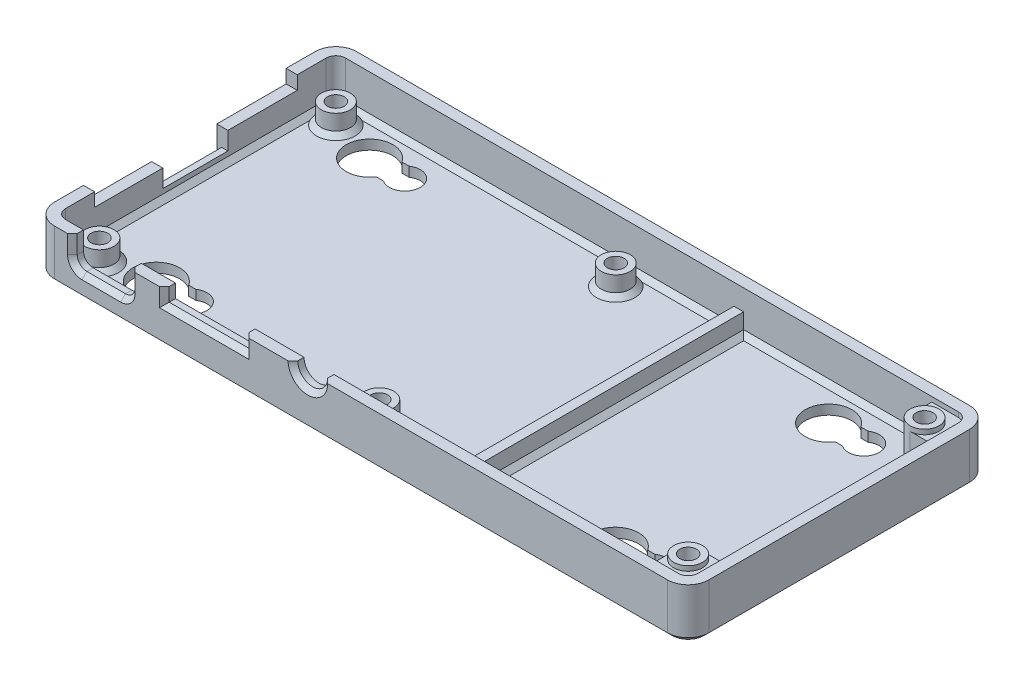
from build123d import *

# Parameters (mm, degrees)
SKETCH3_W                                         = 135.6
SKETCH3_H                                         = 62.6
SKETCH3_W_2                                       = 131
SKETCH3_H_2                                       = 58
BOSS_EXTRUDE1_DEPTH                               = 10.5
SKETCH5_W                                         = 131
SKETCH5_H                                         = 58
BOSS_EXTRUDE2_DEPTH                               = 2
SKETCH6_R                                         = 3
BOSS_EXTRUDE3_DEPTH                               = 4.2
SKETCH10_W                                        = 2
SKETCH10_H                                        = 58
BOSS_EXTRUDE4_DEPTH                               = 4.2
CUT_EXTRUDE1_REACH                                = 100.149
SKETCH11_R                                        = 3.1
SKETCH11_W                                        = 12
SKETCH11_H                                        = 5.8
SKETCH11_W_2                                      = 16.5
SKETCH11_H_2                                      = 2.8
CUT_EXTRUDE2_REACH                                = 142.29
SKETCH12_W                                        = 42
SKETCH12_H                                        = 2.8
SKETCH12_W_2                                      = 13.5
SKETCH12_H_2                                      = 3.7
FILLET6_R                                         = 2
FILLET8_R                                         = 2
CHAMFER1_SIZE                                     = 1
BOSS_EXTRUDE7_DEPTH                               = 8.5
FILLET20_R                                        = 4.3
CHAMFER5_SIZE                                     = 1
CSK_FOR_4_FLAT_HEAD_SOCKET_CAP_SCREW1_D           = 3.4544
CSK_FOR_4_FLAT_HEAD_SOCKET_CAP_SCREW1_DEPTH       = 14
CSK_FOR_4_FLAT_HEAD_SOCKET_CAP_SCREW1_CSINK_D     = 6.723761
CSK_FOR_4_FLAT_HEAD_SOCKET_CAP_SCREW1_CSINK_ANGLE = 82
CSK_FOR_4_FLAT_HEAD_SOCKET_CAP_SCREW1_TIP         = 1.037806461
CHAMFER7_SIZE                                     = 1
CUT_EXTRUDE3_START                                = -1
CUT_EXTRUDE3_DEPTH                                = 1
FILLET21_R                                        = 2
CHAMFER9_SIZE                                     = 1
CHAMFER10_SIZE                                    = 1
CUT_EXTRUDE4_DEPTH                                = 83.826966893


with BuildPart() as part:
    # Sketch3 → Boss-Extrude1 (new body)
    with BuildSketch(Plane(origin=(0, 0, 0), x_dir=(1, 0, 0), z_dir=(0, 1, 0))):
        with Locations((-7.061766162, 3.105993834)):
            Rectangle(SKETCH3_W, SKETCH3_H)
        with Locations((-7.061766162, 3.105993834)):
            Rectangle(SKETCH3_W_2, SKETCH3_H_2, mode=Mode.SUBTRACT)
    extrude(amount=BOSS_EXTRUDE1_DEPTH)

    # Sketch5 → Boss-Extrude2 (add)
    with BuildSketch(Plane(origin=(0, 0, 0), x_dir=(1, 0, 0), z_dir=(0, 1, 0))):
        with Locations((-7.061766162, 3.105993834)):
            Rectangle(SKETCH5_W, SKETCH5_H)
    extrude(amount=BOSS_EXTRUDE2_DEPTH)

    # Sketch6 → Boss-Extrude3 (add)
    with BuildSketch(Plane(origin=(0, 2, 0), x_dir=(1, 0, 0), z_dir=(0, 1, 0))):
        with Locations(Location((-68.061766162, 27.605993834, 0), (0, 0, 270))):
            Circle(SKETCH6_R)
        with Locations(Location((-68.061766162, -21.394006166, 0), (0, 0, 270))):
            Circle(SKETCH6_R)
        with Locations(Location((-10.061766162, -21.394006166, 0), (0, 0, 270))):
            Circle(SKETCH6_R)
        with Locations(Location((-10.061766162, 27.605993834, 0), (0, 0, 270))):
            Circle(SKETCH6_R)
    extrude(amount=BOSS_EXTRUDE3_DEPTH)

    # Sketch10 → Boss-Extrude4 (add)
    with BuildSketch(Plane(origin=(0, 2, 0), x_dir=(1, 0, 0), z_dir=(0, 1, 0))):
        with Locations((10.938233838, 3.105993834)):
            Rectangle(SKETCH10_W, SKETCH10_H)
    extrude(amount=BOSS_EXTRUDE4_DEPTH)

    # Sketch11 → Cut-Extrude1 (cut, up to next)
    with BuildSketch(Plane.XY.offset(28.194006166), mode=Mode.PRIVATE) as cut_extrude1_sk1:
        with Locations((-18.061766162, 10.5)):
            Circle(SKETCH11_R)
    cut_extrude1_tool1 = extrude(cut_extrude1_sk1.sketch, amount=-CUT_EXTRUDE1_REACH, mode=Mode.PRIVATE) & part.part
    # Sketch11 → Cut-Extrude1 (cut, up to next)
    with BuildSketch(Plane.XY.offset(28.194006166), mode=Mode.PRIVATE) as cut_extrude1_sk2:
        with Locations((-60.861766162, 7.6)):
            Rectangle(SKETCH11_W, SKETCH11_H)
    cut_extrude1_tool2 = extrude(cut_extrude1_sk2.sketch, amount=-CUT_EXTRUDE1_REACH, mode=Mode.PRIVATE) & part.part
    # Sketch11 → Cut-Extrude1 (cut, up to next)
    with BuildSketch(Plane.XY.offset(28.194006166), mode=Mode.PRIVATE) as cut_extrude1_sk3:
        with Locations((-39.561766162, 9.1)):
            Rectangle(SKETCH11_W_2, SKETCH11_H_2)
    cut_extrude1_tool3 = extrude(cut_extrude1_sk3.sketch, amount=-CUT_EXTRUDE1_REACH, mode=Mode.PRIVATE) & part.part
    add(cut_extrude1_tool1.solids().sort_by_distance((-18.061766, 10.5, 28.194006))[0], mode=Mode.SUBTRACT)
    add(cut_extrude1_tool2.solids().sort_by_distance((-60.861766, 7.6, 28.194006))[0], mode=Mode.SUBTRACT)
    add(cut_extrude1_tool3.solids().sort_by_distance((-39.561766, 9.1, 28.194006))[0], mode=Mode.SUBTRACT)

    # Sketch12 → Cut-Extrude2 (cut, up to next)
    with BuildSketch(Plane.ZY.offset(74.861766162), mode=Mode.PRIVATE) as cut_extrude2_sk1:
        with Locations((-3.105993834, 9.1)):
            Rectangle(SKETCH12_W, SKETCH12_H)
    cut_extrude2_tool1 = extrude(cut_extrude2_sk1.sketch, amount=-CUT_EXTRUDE2_REACH, mode=Mode.PRIVATE) & part.part
    # Sketch12 → Cut-Extrude2 (cut, up to next)
    with BuildSketch(Plane.ZY.offset(74.861766162), mode=Mode.PRIVATE) as cut_extrude2_sk2:
        with Locations((-2.982922372, 5.85)):
            Rectangle(SKETCH12_W_2, SKETCH12_H_2)
    cut_extrude2_tool2 = extrude(cut_extrude2_sk2.sketch, amount=-CUT_EXTRUDE2_REACH, mode=Mode.PRIVATE) & part.part
    add(cut_extrude2_tool1.solids().sort_by_distance((-74.861766, 9.1, -3.105994))[0], mode=Mode.SUBTRACT)
    add(cut_extrude2_tool2.solids().sort_by_distance((-74.861766, 5.85, -2.982922))[0], mode=Mode.SUBTRACT)

    # Fillet6
    fillet6_edges = [part.edges().sort_by_distance(p)[0] for p in [
        (58.438233838, 6.25, -32.105993834),
    ]]
    fillet(fillet6_edges, radius=FILLET6_R)

    # Fillet8
    fillet8_edges = [part.edges().sort_by_distance(p)[0] for p in [
        (-72.561766162, 6.25, -32.105993834),
        (-72.561766162, 6.25, 25.894006166),
    ]]
    fillet(fillet8_edges, radius=FILLET8_R)

    # Chamfer1
    chamfer1_edges = [part.edges().sort_by_distance(p)[0] for p in [
        (-68.061766162, 2, -30.605993834),
        (-68.061766162, 2, 18.394006166),
        (-10.061766162, 2, 18.394006166),
        (-10.061766162, 2, -30.605993834),
    ]]
    chamfer(chamfer1_edges, length=CHAMFER1_SIZE)

    # Sketch24 → Boss-Extrude7 (add)
    with BuildSketch(Plane(origin=(0, 2, 0), x_dir=(1, 0, 0), z_dir=(0, 1, 0))):
        with BuildLine():
            Line((53.938233838, -18.394006166), (58.438233838, -18.394006166))
            Line((58.438233838, -18.394006166), (58.438233838, -25.894006166))
            Line((58.438233838, -25.894006166), (50.938233838, -25.894006166))
            Line((50.938233838, -25.894006166), (50.938233838, -21.394006166))
            ThreePointArc((50.938233838, -21.394006166), (51.816913494, -19.272685822), (53.938233838, -18.394006166))
        make_face()
        with BuildLine():
            Line((50.938233838, 27.605993834), (50.938233838, 32.105993834))
            Line((50.938233838, 32.105993834), (58.438233838, 32.105993834))
            Line((58.438233838, 32.105993834), (58.438233838, 24.605993834))
            Line((58.438233838, 24.605993834), (53.938233838, 24.605993834))
            ThreePointArc((53.938233838, 24.605993834), (51.816913494, 25.484673491), (50.938233838, 27.605993834))
        make_face()
    extrude(amount=BOSS_EXTRUDE7_DEPTH)

    # Fillet20
    fillet20_edges = [part.edges().sort_by_distance(p)[0] for p in [
        (-74.861766162, 5.25, -34.405993834),
        (60.738233838, 5.25, -34.405993834),
        (60.738233838, 5.25, 28.194006166),
        (-74.861766162, 5.25, 28.194006166),
    ]]
    fillet(fillet20_edges, radius=FILLET20_R)

    # Chamfer5
    # the kernel refuses this chamfer: 1 mm, written as the material it adds along each edge
    with BuildSketch(Plane(origin=(-72.561766162, 2, 23.894006166), x_dir=(-0.027495876610568366, 0.9996219169112972, 0), z_dir=(0, 0, -1))) as chamfer5_piece_1:
        Polygon((CHAMFER5_SIZE * 0.999621916911, CHAMFER5_SIZE * 0.0274958766106), (-CHAMFER5_SIZE * 0.0274958766106, CHAMFER5_SIZE * 0.999621916911), (0, 0), align=None)
    extrude(amount=54)
    with BuildSketch(Plane(origin=(12.509916826, 2, 25.894006166), x_dir=(0, 0.9996219169112968, 0.027495876610585623), z_dir=(-1, 0, 0))) as chamfer5_piece_2:
        Polygon((CHAMFER5_SIZE * 0.999621916911, CHAMFER5_SIZE * 0.0274958766106), (-CHAMFER5_SIZE * 0.0274958766106, CHAMFER5_SIZE * 0.999621916911), (0, 0), align=None)
    extrude(amount=83.071682988)
    with BuildSketch(Plane(origin=(-70.561766162, 2, -30.105993834), x_dir=(0, 0, -1), z_dir=(1, 0, 0))) as chamfer5_piece_3:
        Polygon((2 - CHAMFER5_SIZE, 0), (2, CHAMFER5_SIZE), (2, 0), align=None)
    revolve(axis=Axis((-70.561766162, 2, -30.105993834), (0, 1, 0)), revolution_arc=90)
    with BuildSketch(Plane(origin=(-70.561766162, 2, 23.894006166), x_dir=(0, 0, 1), z_dir=(1, 0, 0))) as chamfer5_piece_4:
        Polygon((2, -CHAMFER5_SIZE), (2 - CHAMFER5_SIZE, 0), (2, 0), align=None)
    revolve(axis=Axis((-70.561766162, 2, 23.894006166), (0, -1, 0)), revolution_arc=90)
    with BuildSketch(Plane(origin=(58.438233838, 2, -27.177676822), x_dir=(-0.9996219169112968, -0.0274958766105862, 0), z_dir=(0, 0, 1))) as chamfer5_piece_5:
        Polygon((CHAMFER5_SIZE * 0.999621916911, -CHAMFER5_SIZE * 0.0274958766106), (-CHAMFER5_SIZE * 0.0274958766106, -CHAMFER5_SIZE * 0.999621916911), (0, 0), align=None)
    extrude(amount=48.143365976)
    with BuildSketch(Plane(origin=(53.938233838, 2, 21.394006166), x_dir=(-1, 0, 0), z_dir=(0, 0, 1))) as chamfer5_piece_6:
        Polygon((3 + CHAMFER5_SIZE, 0), (3, -CHAMFER5_SIZE), (3, 0), align=None)
    revolve(axis=Axis((53.938233838, 2, 21.394006166), (0, -1, 0)), revolution_arc=90)
    with BuildSketch(Plane(origin=(50.938233838, 2, 25.894006166), x_dir=(-0.9996219169112968, -0.0274958766105862, 0), z_dir=(0, 0, -1)), Plane(origin=(53.938233838, 2, 18.394006166), x_dir=(0, -0.027495876610586296, -0.9996219169112968), z_dir=(1, 0, 0)), Plane(origin=(58.438233838, 2, -24.605993834), x_dir=(0, -0.027495876610586296, 0.9996219169112968), z_dir=(-1, 0, 0)), Plane(origin=(50.938233838, 2, -27.605993834), x_dir=(-0.9996219169112968, -0.0274958766105862, 0), z_dir=(0, 0, -1))) as chamfer5_piece_7:
        Polygon((CHAMFER5_SIZE * 0.999621916911, CHAMFER5_SIZE * 0.0274958766106), (-CHAMFER5_SIZE * 0.0274958766106, CHAMFER5_SIZE * 0.999621916911), (0, 0), align=None)
    extrude(amount=4.5)
    with BuildSketch(Plane(origin=(9.36655085, 2, -32.105993834), x_dir=(0, -0.027495876610586296, 0.9996219169112968), z_dir=(1, 0, 0))) as chamfer5_piece_8:
        Polygon((CHAMFER5_SIZE * 0.999621916911, -CHAMFER5_SIZE * 0.0274958766106), (-CHAMFER5_SIZE * 0.0274958766106, -CHAMFER5_SIZE * 0.999621916911), (0, 0), align=None)
    extrude(amount=44.143365976)
    with BuildSketch(Plane(origin=(53.938233838, 2, -27.605993834), x_dir=(0, 0, 1), z_dir=(1, 0, 0))) as chamfer5_piece_9:
        Polygon((3 + CHAMFER5_SIZE, 0), (3, -CHAMFER5_SIZE), (3, 0), align=None)
    revolve(axis=Axis((53.938233838, 2, -27.605993834), (0, -1, 0)), revolution_arc=90)
    with BuildSketch(Plane(origin=(53.509916826, 2, 25.894006166), x_dir=(0, 0.9996219169112968, 0.027495876610585623), z_dir=(-1, 0, 0))) as chamfer5_piece_10:
        Polygon((CHAMFER5_SIZE * 0.999621916911, CHAMFER5_SIZE * 0.0274958766106), (-CHAMFER5_SIZE * 0.0274958766106, CHAMFER5_SIZE * 0.999621916911), (0, 0), align=None)
    extrude(amount=44.143365976)
    with BuildSketch(Plane(origin=(-70.561766162, 2, -32.105993834), x_dir=(0, -0.027495876610586296, 0.9996219169112968), z_dir=(1, 0, 0))) as chamfer5_piece_11:
        Polygon((CHAMFER5_SIZE * 0.999621916911, -CHAMFER5_SIZE * 0.0274958766106), (-CHAMFER5_SIZE * 0.0274958766106, -CHAMFER5_SIZE * 0.999621916911), (0, 0), align=None)
    extrude(amount=83.071682988)
    with BuildSketch(Plane(origin=(9.938233838, 2, 25.894006166), x_dir=(-0.9996219169112968, -0.027495876610586296, 0), z_dir=(0, 0, -1))) as chamfer5_piece_12:
        Polygon((CHAMFER5_SIZE * 0.999621916911, CHAMFER5_SIZE * 0.0274958766106), (-CHAMFER5_SIZE * 0.0274958766106, CHAMFER5_SIZE * 0.999621916911), (0, 0), align=None)
    extrude(amount=58)
    with BuildSketch(Plane(origin=(11.938233838, 2, -32.105993834), x_dir=(-0.027495876610585623, 0.9996219169112968, 0), z_dir=(0, 0, 1))) as chamfer5_piece_13:
        Polygon((CHAMFER5_SIZE * 0.999621916911, -CHAMFER5_SIZE * 0.0274958766106), (-CHAMFER5_SIZE * 0.0274958766106, -CHAMFER5_SIZE * 0.999621916911), (0, 0), align=None)
    extrude(amount=58)

    # CSK for #4 Flat Head Socket Cap Screw1
    with Locations(Plane(origin=(0, 0, 0), x_dir=(-1, 0, 0), z_dir=(0, -1, 0))):
        with Locations((68.061766162, 27.605993834), (68.061766162, -21.394006166), (-53.938233838, 27.605993834), (-53.938233838, -21.394006166), (10.061766162, -21.394006166), (10.061766162, 27.605993834)):
            CounterSinkHole(CSK_FOR_4_FLAT_HEAD_SOCKET_CAP_SCREW1_D / 2, CSK_FOR_4_FLAT_HEAD_SOCKET_CAP_SCREW1_CSINK_D / 2, depth=CSK_FOR_4_FLAT_HEAD_SOCKET_CAP_SCREW1_DEPTH, counter_sink_angle=CSK_FOR_4_FLAT_HEAD_SOCKET_CAP_SCREW1_CSINK_ANGLE)
            with Locations((0, 0, -(CSK_FOR_4_FLAT_HEAD_SOCKET_CAP_SCREW1_DEPTH + CSK_FOR_4_FLAT_HEAD_SOCKET_CAP_SCREW1_TIP / 2))):  # 118° drill point
                Cone(0, CSK_FOR_4_FLAT_HEAD_SOCKET_CAP_SCREW1_D / 2, CSK_FOR_4_FLAT_HEAD_SOCKET_CAP_SCREW1_TIP, mode=Mode.SUBTRACT)

    # Chamfer7
    chamfer7_edges = [part.edges().sort_by_distance(p)[0] for p in [
        (-7.061766162, 0, -34.405993834),
        (-74.861766162, 0, -3.105993834),
        (60.738233838, 0, -3.105993834),
        (-7.061766162, 0, 28.194006166),
        (59.478792997, 0, 26.934565325),
        (-73.602325321, 0, 26.934565325),
        (-73.602325321, 0, -33.146552993),
        (59.478792997, 0, -33.146552993),
    ]]
    chamfer(chamfer7_edges, length=CHAMFER7_SIZE)

    # Sketch29 → Cut-Extrude3 (cut)
    with BuildSketch(Plane(origin=(0, 10.5, 0), x_dir=(1, 0, 0), z_dir=(0, 1, 0)).offset(CUT_EXTRUDE3_START)):
        with BuildLine():
            Line((53.938233838, 24.605993834), (58.438233838, 24.605993834))
            Line((58.438233838, 24.605993834), (58.438233838, 30.105993834))
            ThreePointArc((58.438233838, 30.105993834), (57.8524474, 31.520207397), (56.438233838, 32.105993834))
            Line((56.438233838, 32.105993834), (50.938233838, 32.105993834))
            Line((50.938233838, 32.105993834), (50.938233838, 27.605993834))
            ThreePointArc((50.938233838, 27.605993834), (56.059554181, 29.727314178), (53.938233838, 24.605993834))
        make_face()
        with BuildLine():
            Line((53.938233838, -18.394006166), (58.438233838, -18.394006166))
            Line((58.438233838, -18.394006166), (58.438233838, -23.894006166))
            ThreePointArc((58.438233838, -23.894006166), (57.8524474, -25.308219728), (56.438233838, -25.894006166))
            Line((56.438233838, -25.894006166), (50.938233838, -25.894006166))
            Line((50.938233838, -25.894006166), (50.938233838, -21.394006166))
            ThreePointArc((50.938233838, -21.394006166), (56.059554181, -23.515326509), (53.938233838, -18.394006166))
        make_face()
    extrude(amount=CUT_EXTRUDE3_DEPTH, mode=Mode.SUBTRACT)

    # Fillet21
    fillet21_edges = [part.edges().sort_by_distance(p)[0] for p in [
        (-66.861766162, 4.7, 27.044006166),
        (-54.861766162, 4.7, 27.044006166),
    ]]
    fillet(fillet21_edges, radius=FILLET21_R)

    # Chamfer9
    chamfer9_edges = [part.edges().sort_by_distance(p)[0] for p in [
        (-18.061766162, 7.4, 28.194006166),
        (-54.861766162, 8.6, 28.194006166),
        (-60.861766162, 4.7, 28.194006166),
        (-55.4475526, 5.285786438, 28.194006166),
        (-66.275979725, 5.285786438, 28.194006166),
        (-66.861766162, 8.6, 28.194006166),
        (-47.811766162, 9.1, 28.194006166),
        (-39.561766162, 7.7, 28.194006166),
        (-31.311766162, 9.1, 28.194006166),
    ]]
    chamfer(chamfer9_edges, length=CHAMFER9_SIZE)

    # Chamfer10
    chamfer10_edges = [part.edges().sort_by_distance(p)[0] for p in [
        (-74.861766162, 4, -2.982922372),
    ]]
    chamfer(chamfer10_edges, length=CHAMFER10_SIZE)

    # Sketch30 → Cut-Extrude4 (cut, through all)
    with BuildSketch(Plane(origin=(0, 2, 0), x_dir=(1, 0, 0), z_dir=(0, 1, 0))):
        with BuildLine():
            Line((42.044179364, 27.788166096), (40.563827779, 27.788166096))
            ThreePointArc((40.563827779, 27.788166096), (31.675959845, 25.130478443), (40.563827779, 22.472790791))
            Line((40.563827779, 22.472790791), (42.044179364, 22.472790791))
            ThreePointArc((42.044179364, 22.472790791), (47.026508273, 25.130478443), (42.044179364, 27.788166096))
        make_face()
        with BuildLine():
            Line((42.044179364, -21.720821879), (40.563827779, -21.720821879))
            ThreePointArc((40.563827779, -21.720821879), (31.675959845, -19.063134227), (40.563827779, -16.405446574))
            Line((40.563827779, -16.405446574), (42.044179364, -16.405446574))
            ThreePointArc((42.044179364, -16.405446574), (47.026508273, -19.063134227), (42.044179364, -21.720821879))
        make_face()
        with BuildLine():
            Line((-53.074552142, -21.720821879), (-54.554903727, -21.720821879))
            ThreePointArc((-54.554903727, -21.720821879), (-63.442771661, -19.063134227), (-54.554903727, -16.405446574))
            Line((-54.554903727, -16.405446574), (-53.074552142, -16.405446574))
            ThreePointArc((-53.074552142, -16.405446574), (-48.092223233, -19.063134227), (-53.074552142, -21.720821879))
        make_face()
        with BuildLine():
            Line((-53.074552142, 22.472790791), (-54.554903727, 22.472790791))
            ThreePointArc((-54.554903727, 22.472790791), (-63.442771661, 25.130478443), (-54.554903727, 27.788166096))
            Line((-54.554903727, 27.788166096), (-53.074552142, 27.788166096))
            ThreePointArc((-53.074552142, 27.788166096), (-48.092223233, 25.130478443), (-53.074552142, 22.472790791))
        make_face()
    extrude(amount=-CUT_EXTRUDE4_DEPTH, mode=Mode.SUBTRACT)


solid = part.part
